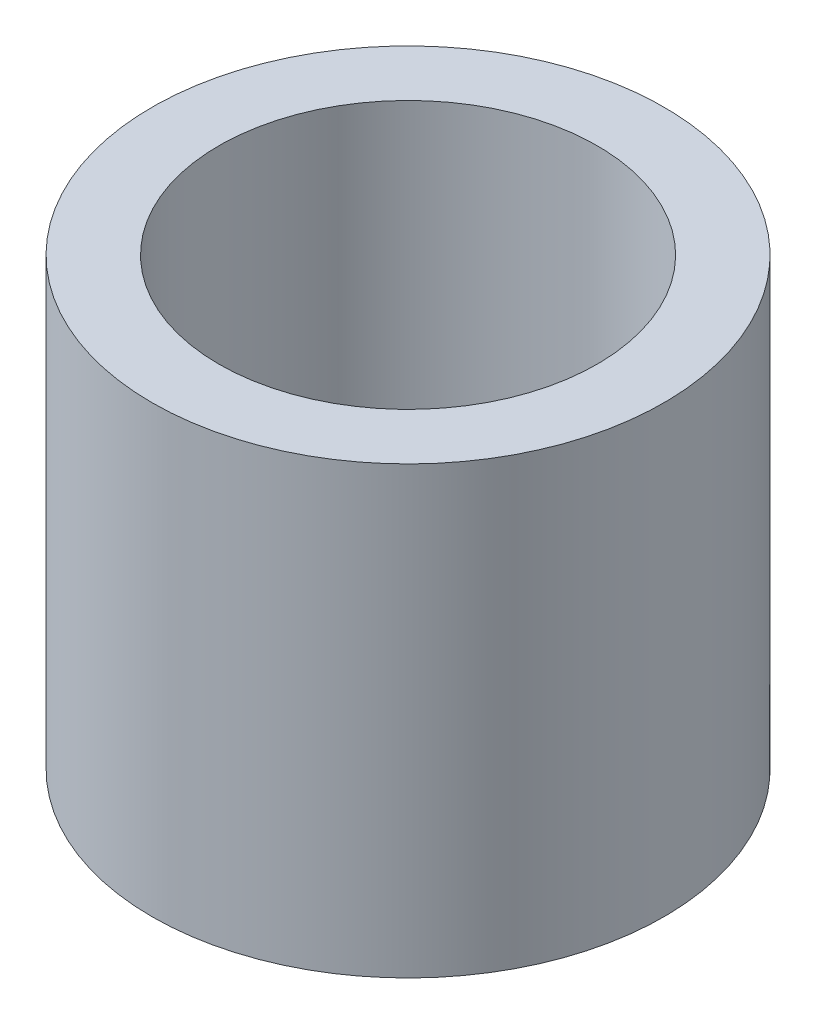
from build123d import *

# Parameters (mm, degrees)
SKETCH_1_R      = 23
EXTRUDE_1_DEPTH = 10
SKETCH_2_R      = 23
SKETCH_2_R_2    = 17
EXTRUDE_2_DEPTH = 30


with BuildPart() as part:
    # Эскиз1 → Бобышка-Вытянуть1 (new body)
    with BuildSketch(Plane(origin=(0, 0, 0), x_dir=(1, 0, 0), z_dir=(0, 1, 0))):
        Circle(SKETCH_1_R)
    extrude(amount=EXTRUDE_1_DEPTH)

    # Эскиз2 → Бобышка-Вытянуть2 (add)
    with BuildSketch(Plane(origin=(0, 10, 0), x_dir=(1, 0, 0), z_dir=(0, 1, 0))):
        Circle(SKETCH_2_R)
        Circle(SKETCH_2_R_2, mode=Mode.SUBTRACT)
    extrude(amount=EXTRUDE_2_DEPTH)


solid = part.part
